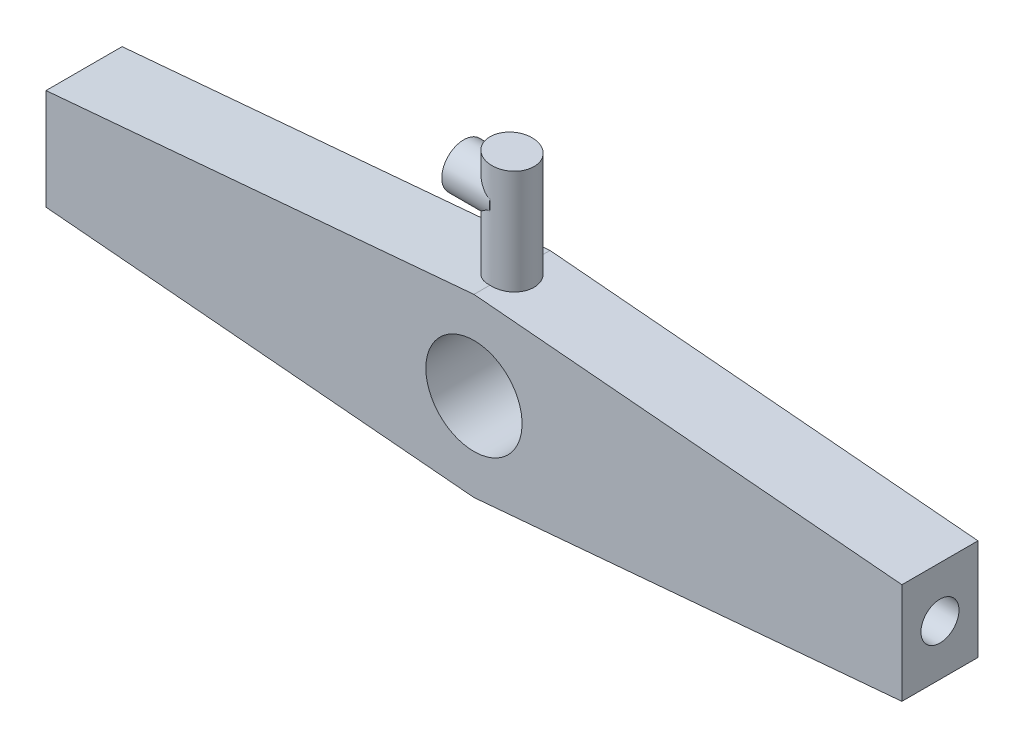
from build123d import *

# Parameters (mm, degrees)
BOSS_EXTRUDE1_DEPTH       = 20.32
SKETCH6_R                 = 4
CUT_EXTRUDE3_DEPTH        = 20.32
SKETCH7_R                 = 4
CUT_EXTRUDE4_DEPTH        = 156.533264109
SKETCH2_W                 = 13.462
SKETCH2_H                 = 20.32
CUT_EXTRUDE5_DEPTH        = 25.4
SKETCH3_W                 = 13.462
SKETCH3_H                 = 20.32
CUT_EXTRUDE6_DEPTH        = 25.4
SKETCH8_W                 = 27.94
SKETCH8_H                 = 13.462
CUT_EXTRUDE7_DEPTH        = 12.7
BOSS_EXTRUDE2_START       = 22
BOSS_EXTRUDE2_OUTLINE_R   = 5.882990069
BOSS_EXTRUDE2_DEPTH       = 29.94796736
BOSS_EXTRUDE2_START_2     = 51.237553192
BOSS_EXTRUDE2_2_OUTLINE_W = 15
BOSS_EXTRUDE2_2_OUTLINE_H = 15
BOSS_EXTRUDE2_2_DEPTH     = 1.762446808
SKETCH10_R                = 5.896741512
BOSS_EXTRUDE3_DEPTH       = 12.7
SKETCH11_R                = 12.85
CUT_EXTRUDE8_DEPTH        = 163.287564874
SKETCH12_W                = 70.353248074
SKETCH12_H                = 156.82271979
SKETCH12_W_2              = 82.216902171
CUT_EXTRUDE10_DEPTH       = 35.56
SKETCH13_R                = 5.08
CUT_EXTRUDE11_DEPTH       = 12.7


with BuildPart() as part:
    # Sketch1 → Boss-Extrude1 (new body)
    with BuildSketch(Plane.XY):
        Polygon((-152.4, 10.16), (-152.4, -10.16), (0, -23.493272321), (152.4, -10.16), (152.4, 10.16), (0, 23.493272321), align=None)
    extrude(amount=BOSS_EXTRUDE1_DEPTH)

    # Sketch6 → Cut-Extrude3 (cut)
    with BuildSketch(Plane.XY.offset(20.32)):
        Circle(SKETCH6_R)
    extrude(amount=-CUT_EXTRUDE3_DEPTH, mode=Mode.SUBTRACT)

    # Sketch7 → Cut-Extrude4 (cut, through all)
    with BuildSketch(Plane.XY.offset(20.32)):
        with Locations((-136.525, 0)):
            Circle(SKETCH7_R)
        with Locations((136.525, 0)):
            Circle(SKETCH7_R)
    extrude(amount=-CUT_EXTRUDE4_DEPTH, mode=Mode.SUBTRACT)

    # Sketch2 → Cut-Extrude5 (cut)
    with BuildSketch(Plane.ZY.offset(152.4)):
        with Locations((10.16, 0)):
            Rectangle(SKETCH2_W, SKETCH2_H)
    extrude(amount=-CUT_EXTRUDE5_DEPTH, mode=Mode.SUBTRACT)

    # Sketch3 → Cut-Extrude6 (cut)
    with BuildSketch(Plane(origin=(152.4, 0, 0), x_dir=(0, 0, -1), z_dir=(1, 0, 0))):
        with Locations((-10.16, 0)):
            Rectangle(SKETCH3_W, SKETCH3_H)
    extrude(amount=-CUT_EXTRUDE6_DEPTH, mode=Mode.SUBTRACT)

    # Sketch8 → Cut-Extrude7 (cut, symmetric)
    with BuildSketch(Plane(origin=(0, 0, 0), x_dir=(1, 0, 0), z_dir=(0, 1, 0))):
        with Locations((-138.43, -10.16)):
            Rectangle(SKETCH8_W, SKETCH8_H)
        with Locations((138.43, -10.16)):
            Rectangle(SKETCH8_W, SKETCH8_H)
    extrude(amount=CUT_EXTRUDE7_DEPTH, both=True, mode=Mode.SUBTRACT)

    # Boss-Extrude2: read off the stored shape, not the designer's step
    # Boss-Extrude2 outline → Boss-Extrude2 (add)
    with BuildSketch(Plane(origin=(0, 0, 0), x_dir=(1, 0, 0), z_dir=(0, 1, 0)).offset(BOSS_EXTRUDE2_START)):
        with Locations((0, -10.16)):
            Circle(BOSS_EXTRUDE2_OUTLINE_R)
    extrude(amount=BOSS_EXTRUDE2_DEPTH)

    # Boss-Extrude2 2 outline → Boss-Extrude2 2 (cut)
    with BuildSketch(Plane(origin=(0, 0, 0), x_dir=(0.9961946980917455, -0.08715574274765747, 0), z_dir=(0.08715574274765747, 0.9961946980917457, 0)).offset(BOSS_EXTRUDE2_START_2)):
        with Locations((-4.5, -10.5)):
            Rectangle(BOSS_EXTRUDE2_2_OUTLINE_W, BOSS_EXTRUDE2_2_OUTLINE_H)
    extrude(amount=BOSS_EXTRUDE2_2_DEPTH, mode=Mode.SUBTRACT)

    # Sketch10 → Boss-Extrude3 (add)
    with BuildSketch(Plane(origin=(0, 0, 0), x_dir=(0, 0, -1), z_dir=(1, 0, 0))):
        with Locations((-10.323488307, 42.031861705)):
            Circle(SKETCH10_R)
    extrude(amount=-BOSS_EXTRUDE3_DEPTH)

    # Sketch11 → Cut-Extrude8 (cut, through all)
    with BuildSketch(Plane(origin=(0, 0, 0), x_dir=(-1, 0, 0), z_dir=(0, 0, -1))):
        Circle(SKETCH11_R)
    extrude(amount=-CUT_EXTRUDE8_DEPTH, mode=Mode.SUBTRACT)

    # Sketch12 → Cut-Extrude10 (cut)
    with BuildSketch(Plane.XY):
        with Locations((149.476624037, 0)):
            Rectangle(SKETCH12_W, SKETCH12_H)
        with Locations((-155.408451086, 0)):
            Rectangle(SKETCH12_W_2, SKETCH12_H)
    extrude(amount=CUT_EXTRUDE10_DEPTH, mode=Mode.SUBTRACT)

    # Sketch13 → Cut-Extrude11 (cut)
    with BuildSketch(Plane.ZY.offset(114.3)):
        with Locations(Location((10.16, 0, 0), (0, 0, 270))):
            Circle(SKETCH13_R)
    cut_extrude11 = extrude(amount=-CUT_EXTRUDE11_DEPTH, mode=Mode.SUBTRACT)

    # Mirror1: Cut-Extrude11 across plane
    add(cut_extrude11.mirror(Plane(origin=(0, 0, 0), x_dir=(0, 0, 1), z_dir=(1, 0, 0))), mode=Mode.SUBTRACT)


solid = part.part
